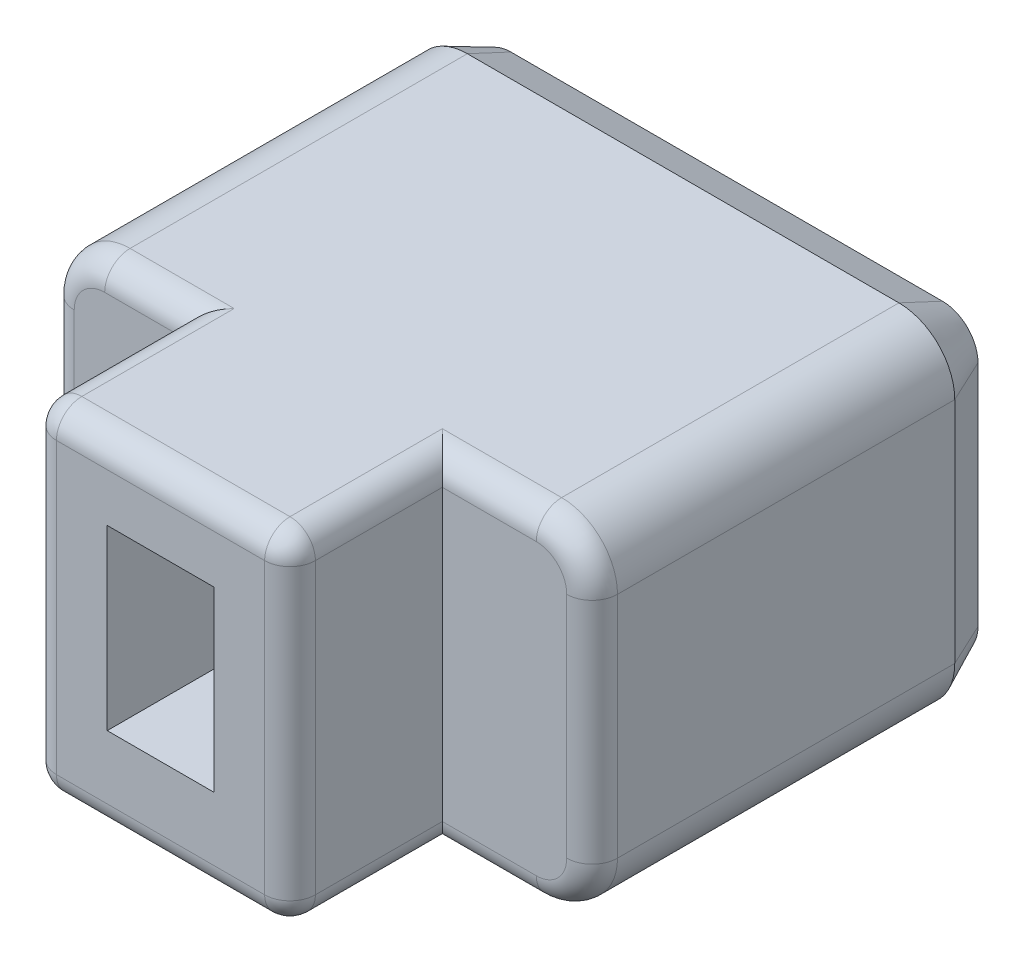
from build123d import *

# Parameters (mm, degrees)
BOSS_EXTRU_1_DEPTH      = 11
ESQUISSE3_W             = 2.1
ESQUISSE3_H             = 3.5
ENL_V_MAT_EXTRU_1_DEPTH = 3
ESQUISSE4_OUTSIDE_W     = 16.048
ESQUISSE4_OUTSIDE_H     = 12.048
ESQUISSE4_OUTSIDE_W_2   = 5.1
ESQUISSE4_OUTSIDE_H_2   = 6.7
ENL_V_MAT_EXTRU_2_DEPTH = 3
CONG_1_R                = 0.5
CHANFREIN1_SIZE         = 0.4
CHANFREIN1_SIZE2        = 0.857802768


with BuildPart() as part:
    # Esquisse2 → Boss.-Extru.1 (new body)
    with BuildSketch(Plane.XY):
        with BuildLine():
            Line((1.1, 0), (9.6, 0))
            ThreePointArc((9.6, 0), (10.377817459, 0.322182541), (10.7, 1.1))
            Line((10.7, 1.1), (10.7, 5.6))
            ThreePointArc((10.7, 5.6), (10.377817459, 6.377817459), (9.6, 6.7))
            Line((9.6, 6.7), (1.1, 6.7))
            ThreePointArc((1.1, 6.7), (0.322182541, 6.377817459), (0, 5.6))
            Line((0, 5.6), (0, 1.1))
            ThreePointArc((0, 1.1), (0.322182541, 0.322182541), (1.1, 0))
        make_face()
    extrude(amount=BOSS_EXTRU_1_DEPTH)

    # Esquisse3 → Enlèv. mat.-Extru.1 (cut)
    with BuildSketch(Plane.XY.offset(11)):
        with Locations((5.2, 3.5)):
            Rectangle(ESQUISSE3_W, ESQUISSE3_H)
    extrude(amount=-ENL_V_MAT_EXTRU_1_DEPTH, mode=Mode.SUBTRACT)

    # Esquisse4 outside → Enlèv. mat.-Extru.2 (cut)
    with BuildSketch(Plane.XY.offset(11)):
        with Locations((5.35, 3.35)):
            Rectangle(ESQUISSE4_OUTSIDE_W, ESQUISSE4_OUTSIDE_H)
        with Locations((5.2, 3.35)):
            Rectangle(ESQUISSE4_OUTSIDE_W_2, ESQUISSE4_OUTSIDE_H_2, mode=Mode.SUBTRACT)
    extrude(amount=-ENL_V_MAT_EXTRU_2_DEPTH, mode=Mode.SUBTRACT)

    # Congé1
    cong_1_edges = [part.edges().sort_by_distance(p)[0] for p in [
        (8.675, 0, 8),
        (10.377817459, 0.322182541, 8),
        (10.7, 3.35, 8),
        (10.377817459, 6.377817459, 8),
        (1.875, 6.7, 8),
        (0.322182541, 6.377817459, 8),
        (1.875, 0, 8),
        (0.322182541, 0.322182541, 8),
        (7.75, 6.7, 9.5),
        (2.65, 6.7, 9.5),
        (7.75, 0, 9.5),
        (2.65, 0, 9.5),
        (2.65, 3.35, 11),
        (5.2, 6.7, 11),
        (7.75, 3.35, 11),
        (5.2, 0, 11),
        (8.675, 6.7, 8),
        (0, 3.35, 8),
    ]]
    fillet(cong_1_edges, radius=CONG_1_R)

    # Chanfrein1
    chanfrein1_edges = [part.edges().sort_by_distance(p)[0] for p in [
        (5.35, 0, 0),
        (10.377817459, 0.322182541, 0),
        (0.322182541, 0.322182541, 0),
        (10.7, 3.35, 0),
        (0, 3.35, 0),
        (10.377817459, 6.377817459, 0),
        (0.322182541, 6.377817459, 0),
        (5.35, 6.7, 0),
    ]]
    chanfrein1_side = [part.faces().sort_by_distance(p)[0] for p in [
        (5.35, 3.35, 0),
    ]]
    chamfer(chanfrein1_edges, length=CHANFREIN1_SIZE, length2=CHANFREIN1_SIZE2, reference=chanfrein1_side[0])


solid = part.part
